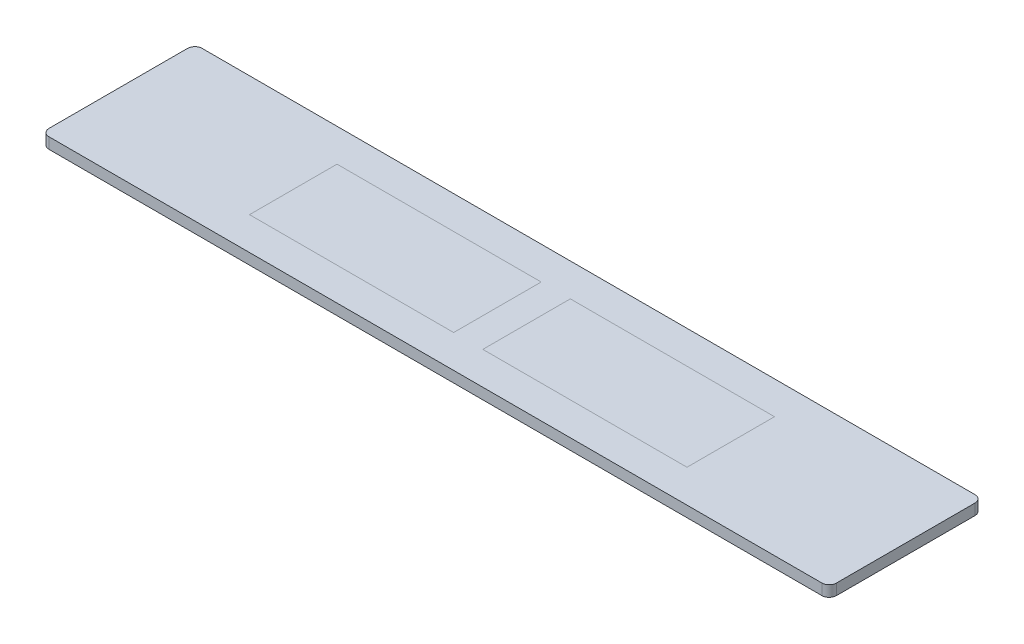
from build123d import *

# Parameters (mm, degrees)
BASE_FLANGE1_START     = -4.7625
BASE_FLANGE1_OUTLINE_W = 685.8
BASE_FLANGE1_OUTLINE_H = 133.35
BASE_FLANGE1_DEPTH     = 9.525
FILLET1_R              = 6.35


# Read off the part's stored shape, not the designer's step: Base-Flange1
with BuildPart() as part:
    # Base-Flange1 outline → Base-Flange1 (new body)
    with BuildSketch(Plane(origin=(0, 0, 0), x_dir=(1, 0, 0), z_dir=(0, 1, 0)).offset(BASE_FLANGE1_START)):
        Rectangle(BASE_FLANGE1_OUTLINE_W, BASE_FLANGE1_OUTLINE_H)
    extrude(amount=BASE_FLANGE1_DEPTH)

    # Fillet1
    fillet1_edges = [part.edges().sort_by_distance(p)[0] for p in [
        (342.9, 0, 66.675),
        (-342.9, 0, 66.675),
        (-342.9, 0, -66.675),
        (342.9, 0, -66.675),
    ]]
    fillet(fillet1_edges, radius=FILLET1_R)


solid = part.part
